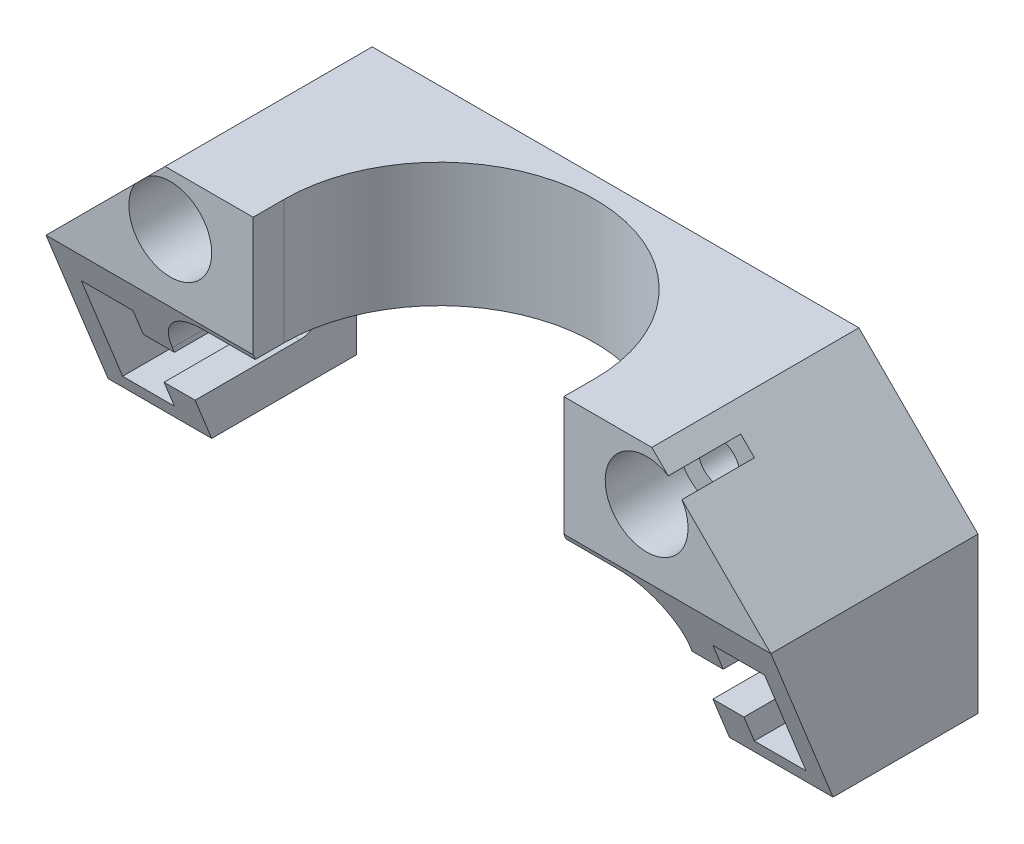
from build123d import *

# Parameters (mm, degrees)
SKETCH1_R               = 2
BOSS_EXTRUDE1_DEPTH     = 20
SKETCH2_W               = 5.5
SKETCH2_H               = 5
SKETCH2_W_2             = 3
SKETCH2_W_3             = 2.5
CUT_EXTRUDE1_DEPTH      = 17
FILLET1_R               = 2.5
FILLET1_OF_MIRROR1_R    = 2.5
CUT_EXTRUDE2_DEPTH      = 43.839817927
CUT_EXTRUDE3_DEPTH      = 46.686431246
CUT_EXTRUDE3_DEPTH_BACK = 46.686431246
SKETCH5_R               = 4
CUT_EXTRUDE4_DEPTH      = 7


with BuildPart() as part:
    # Sketch1 → Boss-Extrude1 (new body)
    with BuildSketch(Plane.XY):
        with BuildLine():
            Line((-23.5, 5), (23.5, 5))
            Line((23.5, 5), (35, -6.5))
            Line((35, -6.5), (35, -21.5))
            Line((35, -21.5), (25, -21.5))
            Line((25, -21.5), (25, -12))
            ThreePointArc((25, -12), (23.535533906, -8.464466094), (20, -7))
            Line((20, -7), (-20, -7))
            ThreePointArc((-20, -7), (-23.535533906, -8.464466094), (-25, -12))
            Line((-25, -12), (-25, -21.5))
            Line((-25, -21.5), (-35, -21.5))
            Line((-35, -21.5), (-35, -6.5))
            Line((-35, -6.5), (-23.5, 5))
        make_face()
        with Locations((-23, 0)):
            Circle(SKETCH1_R, mode=Mode.SUBTRACT)
        with Locations((23, 0)):
            Circle(SKETCH1_R, mode=Mode.SUBTRACT)
    extrude(amount=BOSS_EXTRUDE1_DEPTH)

    # Sketch2 → Cut-Extrude1 (cut)
    with BuildSketch(Plane.XY.offset(20)):
        with Locations((-22.25, -15)):
            Rectangle(SKETCH2_W, SKETCH2_H)
        with Locations((-26.5, -15)):
            Rectangle(SKETCH2_W_2, SKETCH2_H)
        with Locations((-29.25, -15)):
            Rectangle(SKETCH2_W_3, SKETCH2_H)
        Polygon((-30.5, -12.5), (-28, -12.5), (-28, -10), (-33, -10), (-33, -20), (-28, -20), (-28, -17.5), (-30.5, -17.5), align=None)
    cut_extrude1 = extrude(amount=-CUT_EXTRUDE1_DEPTH, mode=Mode.SUBTRACT)

    # Fillet1
    fillet1_edges = [part.edges().sort_by_distance(p)[0] for p in [
        (-26.5, -17.5, 3),
        (-26.5, -12.5, 3),
    ]]
    fillet(fillet1_edges, radius=FILLET1_R - 0.0001)  # a hair under: the kernel refuses the full size

    # Mirror1: Cut-Extrude1 across plane
    add(cut_extrude1.mirror(Plane(origin=(0, 0, 0), x_dir=(0, 0, 1), z_dir=(1, 0, 0))), mode=Mode.SUBTRACT)

    # Fillet1 of Mirror1
    fillet1_of_mirror1_edges = [part.edges().sort_by_distance(p)[0] for p in [
        (26.5, -17.5, 3),
        (26.5, -12.5, 3),
    ]]
    fillet(fillet1_of_mirror1_edges, radius=FILLET1_OF_MIRROR1_R - 0.0001)  # a hair under: the kernel refuses the full size

    # Sketch3 → Cut-Extrude2 (cut, through all)
    with BuildSketch(Plane.XZ.offset(7)):
        with BuildLine():
            Line((-15, 47), (15, 47))
            Line((15, 47), (15, 17))
            ThreePointArc((15, 17), (0, 2), (-15, 17))
            Line((-15, 17), (-15, 47))
        make_face()
    extrude(amount=-CUT_EXTRUDE2_DEPTH, mode=Mode.SUBTRACT)

    # Sketch4 → Cut-Extrude3 (cut, two sides: drawn at the far end of the back side and taken through both)
    with BuildSketch(Plane(origin=(0, 0, 0), x_dir=(0, 0, -1), z_dir=(1, 0, 0)).offset(-CUT_EXTRUDE3_DEPTH_BACK)):
        Polygon((-14, -21.5), (-20, -6.5), (-20, -21.5), align=None)
    extrude(amount=CUT_EXTRUDE3_DEPTH + CUT_EXTRUDE3_DEPTH_BACK, mode=Mode.SUBTRACT)

    # Sketch5 → Cut-Extrude4 (cut)
    with BuildSketch(Plane.XY.offset(20)):
        with Locations((-23, 0)):
            Circle(SKETCH5_R)
        with Locations((23, 0)):
            Circle(SKETCH5_R)
    extrude(amount=-CUT_EXTRUDE4_DEPTH, mode=Mode.SUBTRACT)


solid = part.part
